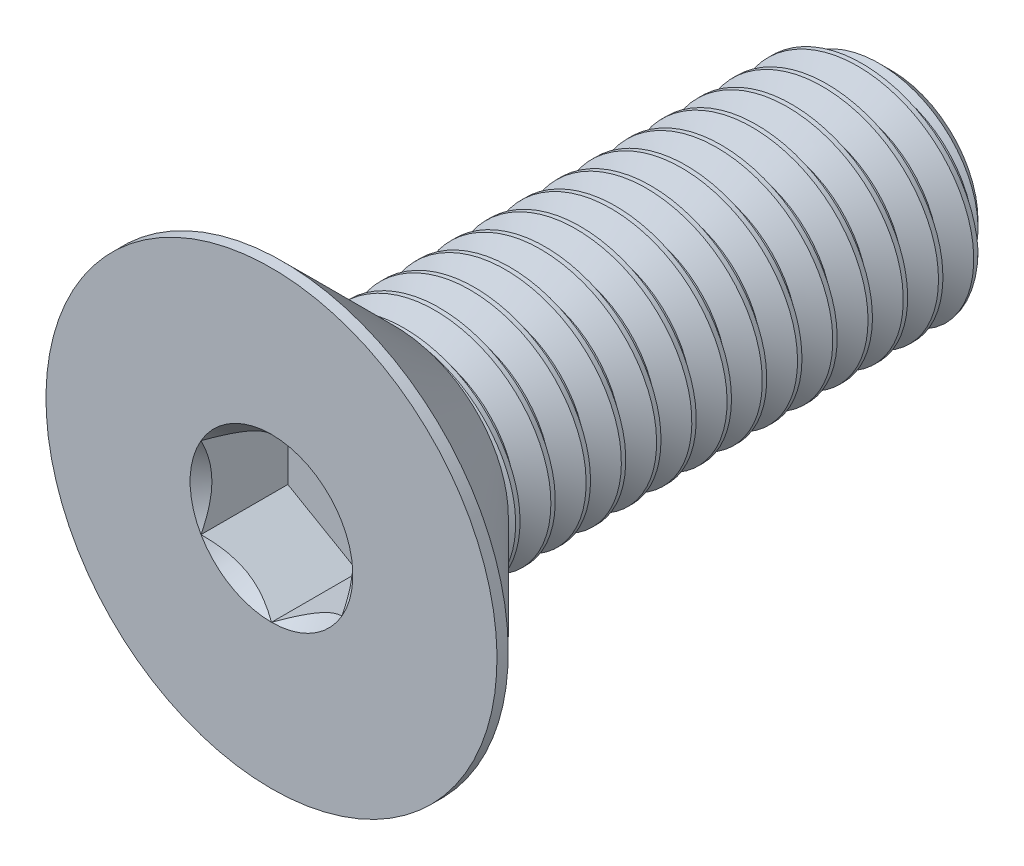
from build123d import *
from build123d.topology import SkipClean

# Parameters (mm, degrees)
SKETCH1_W          = 22
SKETCH1_H          = 4
CHAMFER1_SIZE      = 0.9375
CUT_SWEEP1_PITCH   = 1.25
CUT_EXTRUDE2_DEPTH = 3.08


with BuildPart() as part:
    # Sketch1 → Revolve1 (revolve)
    with BuildSketch(Plane(origin=(0, 0, 0), x_dir=(0, 0, -1), z_dir=(1, 0, 0))):
        with Locations((11, 2)):
            Rectangle(SKETCH1_W, SKETCH1_H)
    revolve(axis=Axis((0, 0, -22), (0, 0, 1)))

    # Chamfer1
    chamfer1_edges = [part.edges().sort_by_distance(p)[0] for p in [
        (0, -4, -22),
    ]]
    chamfer(chamfer1_edges, length=CHAMFER1_SIZE)

    # Cut-Sweep1: the profile of Sketch2 profile screwed along a right-hand helix of 17.6 turns, 8 arcs to a turn; built about Z, then put on its axis
    with SkipClean():  # the faces are left unmerged after this step: merging them gives an invalid solid
        cut_sweep1_z = Axis((0, 0, 0), (0, 0, 1))
        cut_sweep1_corners = [(4.0003, 0, 0.000173205), (4.0003, 0, -1.093923205), (3.188101184, 0, -0.625), (3.188101184, 0, -0.46875)]
        with BuildLine(mode=Mode.PRIVATE) as cut_sweep1_profile:
            Line(cut_sweep1_corners[0], cut_sweep1_corners[1])
            Line(cut_sweep1_corners[1], cut_sweep1_corners[2])
            Line(cut_sweep1_corners[2], cut_sweep1_corners[3])
            Line(cut_sweep1_corners[3], cut_sweep1_corners[0])
        cut_sweep1_cap = Face(cut_sweep1_profile.wire())
        cut_sweep1_turn_angles = [0, 22.5, 45, 67.5, 90, 112.5, 135, 157.5, 180, 202.5, 225, 247.5, 270, 292.5, 315, 337.5, 360]
        cut_sweep1_turn_weights = [1, 0.9238795325112867, 1, 0.9238795325112867, 1, 0.9238795325112867, 1, 0.9238795325112867, 1, 0.9238795325112867, 1, 0.9238795325112867, 1, 0.9238795325112867, 1, 0.9238795325112867, 1]
        cut_sweep1_turn_rails = [Edge.make_bspline([Vector(p[0], p[1], 0).rotate(cut_sweep1_z, cut_sweep1_turn_angles[k]) / cut_sweep1_turn_weights[k] + Vector(0, 0, p[2] + CUT_SWEEP1_PITCH * cut_sweep1_turn_angles[k] / 360) for k in range(17)], [0, 0, 0, 1, 1, 2, 2, 3, 3, 4, 4, 5, 5, 6, 6, 7, 7, 8, 8, 8], 2, cut_sweep1_turn_weights) for p in cut_sweep1_corners]
        cut_sweep1_turn_sides = [Face.make_surface_from_curves(cut_sweep1_turn_rails[p[0]], cut_sweep1_turn_rails[p[1]]) for p in [(0, 1), (1, 2), (2, 3), (3, 0)]]
        cut_sweep1_last_angles = [6120, 6142.5, 6165, 6187.5, 6210, 6232.5, 6255, 6277.5, 6300, 6318, 6336]
        cut_sweep1_last_weights = [1, 0.9238795325112867, 1, 0.9238795325112867, 1, 0.9238795325112867, 1, 0.9238795325112867, 1, 0.9510565162951413, 1]
        cut_sweep1_last_rails = [Edge.make_bspline([Vector(p[0], p[1], 0).rotate(cut_sweep1_z, cut_sweep1_last_angles[k]) / cut_sweep1_last_weights[k] + Vector(0, 0, p[2] + CUT_SWEEP1_PITCH * cut_sweep1_last_angles[k] / 360) for k in range(11)], [0, 0, 0, 1, 1, 2, 2, 3, 3, 4, 4, 5, 5, 5], 2, cut_sweep1_last_weights) for p in cut_sweep1_corners]
        cut_sweep1_last_sides = [Face.make_surface_from_curves(cut_sweep1_last_rails[p[0]], cut_sweep1_last_rails[p[1]]) for p in [(0, 1), (1, 2), (2, 3), (3, 0)]]
        cut_sweep1 = Plane(origin=(0, 0, -22), x_dir=(0, 1, 0), z_dir=(0, 0, 1)) * Solid(Shell([*[p.moved(Location((0, 0, CUT_SWEEP1_PITCH * i))) for i in range(17) for p in cut_sweep1_turn_sides], *cut_sweep1_last_sides, cut_sweep1_cap, cut_sweep1_cap.rotate(cut_sweep1_z, 6336).moved(Location((0, 0, CUT_SWEEP1_PITCH * 6336 / 360)))]))
        add(cut_sweep1, mode=Mode.SUBTRACT)

    # Sketch7 → Revolve2 (revolve)
    with BuildSketch(Plane(origin=(0, 0, 0), x_dir=(0, 0, -1), z_dir=(1, 0, 0)), mode=Mode.PRIVATE) as revolve2_sk:
        Polygon((0, 8), (0.4, 8), (4.4, 4), (4.4, 0), (0, 0), align=None)
    revolve(revolve2_sk.sketch.rotate(Axis((0, 0, 0), (0, 0, -1)), 189.052465709), axis=Axis((0, 0, 0), (0, 0, -1)))

    # Boss-Extrude1 cone 1 section (through the dimple's axis) → Boss-Extrude1 (revolve)
    with SkipClean():  # the faces are left unmerged after this step: merging them gives an invalid solid
        with BuildSketch(Plane(origin=(0, 0, -4.4), x_dir=(0, -1, 0), z_dir=(1, 0, 0))):
            Polygon((0, 0), (4, 0), (0, 4), align=None)
        revolve(axis=Axis((0, 0, -4.4), (0, 0, -1)))

    # Sketch5 → Cut-Extrude2 (cut)
    with SkipClean():  # the faces are left unmerged after this step: merging them gives an invalid solid
        with BuildSketch(Plane.XY):
            Polygon((2.5, -1.443375673), (2.5, 1.443375673), (0, 2.886751346), (-2.5, 1.443375673), (-2.5, -1.443375673), (0, -2.886751346), align=None)
        extrude(amount=-CUT_EXTRUDE2_DEPTH, mode=Mode.SUBTRACT)

    # Cut-Extrude3 cone 1 section (through the dimple's axis) → Cut-Extrude3 (revolve, cut)
    with SkipClean():  # the faces are left unmerged after this step: merging them gives an invalid solid
        with BuildSketch(Plane(origin=(0, 0, 0), x_dir=(0, -1, 0), z_dir=(1, 0, 0))):
            Polygon((0, 0), (2.886751346, 0), (0, 2.886751346), align=None)
        revolve(axis=Axis((0, 0, 0), (0, 0, -1)), mode=Mode.SUBTRACT)


solid = part.part
